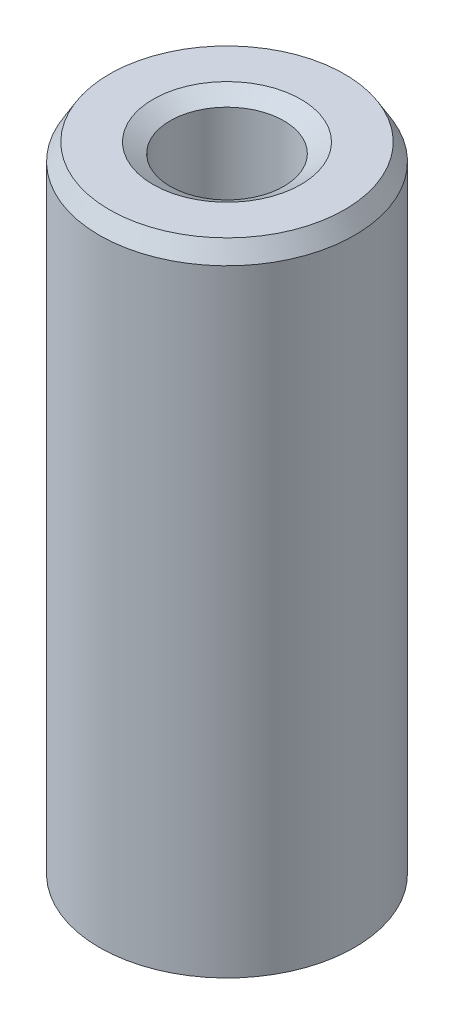
from build123d import *
from OCP.BRepFilletAPI import BRepFilletAPI_MakeChamfer

# Parameters (mm, degrees)
SKETCH1_R           = 7.5
BOSS_EXTRUDE1_DEPTH = 37.842115429
SKETCH2_R           = 3.340506491
CUT_EXTRUDE1_DEPTH  = 40.300454197
CHAMFER1_SIZE       = 1.003312161
CHAMFER1_SIZE2      = 0.592250997


with BuildPart() as part:
    # Sketch1 → Boss-Extrude1 (new body)
    with BuildSketch(Plane(origin=(0, 0, 0), x_dir=(1, 0, 0), z_dir=(0, 1, 0))):
        Circle(SKETCH1_R)
    extrude(amount=BOSS_EXTRUDE1_DEPTH)

    # Sketch2 → Cut-Extrude1 (cut, through all)
    with BuildSketch(Plane(origin=(0, 0, 0), x_dir=(1, 0, 0), z_dir=(0, 1, 0))):
        Circle(SKETCH2_R)
    extrude(amount=CUT_EXTRUDE1_DEPTH, mode=Mode.SUBTRACT)

    # Chamfer1: one chamfer whose edges measure the first distance from different faces: ONE call of the kernel's chamfer builder (chamfer() names one face for all edges)
    chamfer1_edges_1 = [part.edges().sort_by_distance(p)[0] for p in [
        (-3.340506491, 37.842115429, 0),
    ]]
    chamfer1_side_1 = [part.faces().sort_by_distance(p)[0] for p in [
        (-7.287867966, 37.842115429, 0),
    ]]
    chamfer1_edges_2 = [part.edges().sort_by_distance(p)[0] for p in [
        (-3.340506491, 0, 0),
    ]]
    chamfer1_side_2 = [part.faces().sort_by_distance(p)[0] for p in [
        (-3.340506491, 18.921057714, 0),
    ]]
    chamfer1_edges_3 = [part.edges().sort_by_distance(p)[0] for p in [
        (-7.5, 0, 0),
    ]]
    chamfer1_side_3 = [part.faces().sort_by_distance(p)[0] for p in [
        (-7.287867966, 0, 0),
    ]]
    chamfer1_edges_4 = [part.edges().sort_by_distance(p)[0] for p in [
        (-7.5, 37.842115429, 0),
    ]]
    chamfer1_side_4 = [part.faces().sort_by_distance(p)[0] for p in [
        (-7.5, 18.921057714, 0),
    ]]
    chamfer1 = BRepFilletAPI_MakeChamfer(part.part.solid().wrapped)
    for e in chamfer1_edges_1:
        chamfer1.Add(CHAMFER1_SIZE, CHAMFER1_SIZE2, e.wrapped, chamfer1_side_1[0].wrapped)  # the first distance lies on this face
    for e in chamfer1_edges_2:
        chamfer1.Add(CHAMFER1_SIZE, CHAMFER1_SIZE2, e.wrapped, chamfer1_side_2[0].wrapped)  # the first distance lies on this face
    for e in chamfer1_edges_3:
        chamfer1.Add(CHAMFER1_SIZE, CHAMFER1_SIZE2, e.wrapped, chamfer1_side_3[0].wrapped)  # the first distance lies on this face
    for e in chamfer1_edges_4:
        chamfer1.Add(CHAMFER1_SIZE, CHAMFER1_SIZE2, e.wrapped, chamfer1_side_4[0].wrapped)  # the first distance lies on this face
    add(Compound.cast(chamfer1.Shape()), mode=Mode.REPLACE)


solid = part.part
